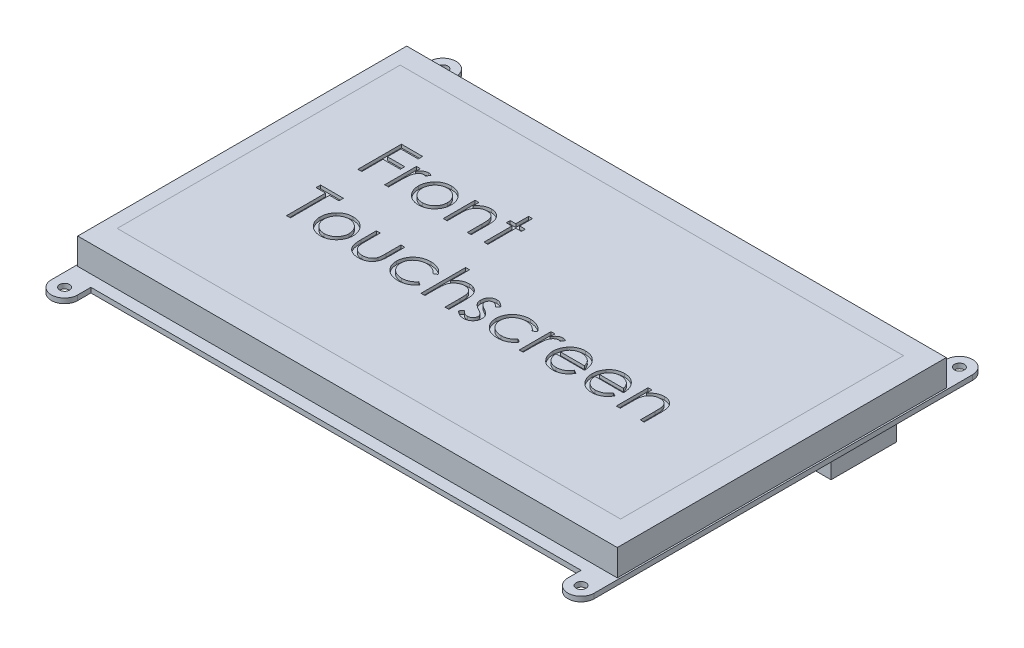
from build123d import *

# Parameters (mm, degrees)
SKETCH1_R           = 1.5
BOSS_EXTRUDE1_DEPTH = 1.5
SKETCH2_W           = 8.49594542
SKETCH2_H           = 19.836738538
SKETCH2_W_2         = 18.514132699
SKETCH2_H_2         = 9.878260544
BOSS_EXTRUDE2_DEPTH = 8
SKETCH3_W           = 164
SKETCH3_H           = 100
BOSS_EXTRUDE3_DEPTH = 8
CUT_EXTRUDE1_DEPTH  = 1


with BuildPart() as part:
    # Sketch1 → Boss-Extrude1 (new body)
    with BuildSketch(Plane(origin=(0, 0, 0), x_dir=(1, 0, 0), z_dir=(0, 1, 0))):
        with BuildLine():
            Line((-74.5, -53.5), (74.5, -53.5))
            Line((74.5, -53.5), (74.5, -57.5))
            ThreePointArc((74.5, -57.5), (78.5, -61.5), (82.5, -57.5))
            Line((82.5, -57.5), (82.5, -23.877612559))
            Line((82.5, -23.877612559), (82.5, 23.877612559))
            Line((82.5, 23.877612559), (82.5, 57.5))
            ThreePointArc((82.5, 57.5), (78.5, 61.5), (74.5, 57.5))
            Line((74.5, 57.5), (74.5, 53.5))
            Line((74.5, 53.5), (-74.5, 53.5))
            Line((-74.5, 53.5), (-74.5, 57.5))
            ThreePointArc((-74.5, 57.5), (-78.5, 61.5), (-82.5, 57.5))
            Line((-82.5, 57.5), (-82.5, 23.877612559))
            Line((-82.5, 23.877612559), (-82.5, -23.877612559))
            Line((-82.5, -23.877612559), (-82.5, -57.5))
            ThreePointArc((-82.5, -57.5), (-78.5, -61.5), (-74.5, -57.5))
            Line((-74.5, -57.5), (-74.5, -53.5))
        make_face()
        with Locations((78.5, 57.5)):
            Circle(SKETCH1_R, mode=Mode.SUBTRACT)
        with Locations((-78.5, 57.5)):
            Circle(SKETCH1_R, mode=Mode.SUBTRACT)
        with Locations((78.5, -57.5)):
            Circle(SKETCH1_R, mode=Mode.SUBTRACT)
        with Locations((-78.5, -57.5)):
            Circle(SKETCH1_R, mode=Mode.SUBTRACT)
    extrude(amount=BOSS_EXTRUDE1_DEPTH)

    # Sketch2 → Boss-Extrude2 (add)
    with BuildSketch(Plane.XZ):
        with Locations((74.922222093, -27.720858346)):
            Rectangle(SKETCH2_W, SKETCH2_H)
        with Locations((-9.25706635, -10.936720321)):
            Rectangle(SKETCH2_W_2, SKETCH2_H_2)
    extrude(amount=BOSS_EXTRUDE2_DEPTH)

    # Sketch3 → Boss-Extrude3 (add)
    with BuildSketch(Plane(origin=(0, 1.5, 0), x_dir=(1, 0, 0), z_dir=(0, 1, 0))):
        Rectangle(SKETCH3_W, SKETCH3_H)
    extrude(amount=BOSS_EXTRUDE3_DEPTH)

    # Sketch5 → Cut-Extrude1 (cut)
    # profile 1 of 16: a face of its own
    with BuildSketch(Plane(origin=(0, 9.5, 0), x_dir=(1, 0, 0), z_dir=(0, 1, 0))):
        Polygon((-56.987931451, 23.371022827), (-50.542952819, 23.371022827), (-50.542952819, 22.01418522), (-55.800698545, 22.01418522), (-55.800698545, 17.9436724), (-50.542952819, 17.9436724), (-50.542952819, 16.586834793), (-55.800698545, 16.586834793), (-55.800698545, 10.14185616), (-56.987931451, 10.14185616), align=None)
    # profile 2 of 16: a face of its own
    with BuildSketch(Plane(origin=(0, 9.5, 0), x_dir=(1, 0, 0), z_dir=(0, 1, 0))):
        with BuildLine():
            Line((-48.84690581, 19.809324109), (-47.659672904, 19.809324109))
            Line((-47.659672904, 19.809324109), (-47.659672904, 18.386234666))
            add(Edge.make_bspline(
                [(-47.659672904, 18.386234666), (-47.572024917, 18.51873735), (-47.404398823, 18.772147705), (-47.125781501, 19.107296551), (-46.840396886, 19.384787947), (-46.546878767, 19.605917319), (-46.243068687, 19.771520476), (-45.935634376, 19.892824508), (-45.619738998, 19.964554241), (-45.407460297, 19.974130868), (-45.301107533, 19.97892881)],
                knots=[0, 0, 0, 0, 1.2804753, 2.448899062, 3.506932113, 4.484331642, 5.4025378, 6.288909075, 7.142734305, 8, 8, 8, 8], degree=3))
            add(Edge.make_bspline(
                [(-45.301107533, 19.97892881), (-45.218609216, 19.974428903), (-45.048863566, 19.965170052), (-44.791905563, 19.900117232), (-44.527157992, 19.796256849), (-44.356530516, 19.69858696), (-44.267578887, 19.647669629)],
                knots=[0, 0, 0, 0, 0.901110191, 1.854092781, 2.881294221, 4, 4, 4, 4], degree=3))
            Line((-44.267578887, 19.647669629), (-44.919496956, 18.61944113))
            add(Edge.make_bspline(
                [(-44.919496956, 18.61944113), (-44.976605459, 18.644917731), (-45.085008329, 18.693277197), (-45.2435866, 18.75051039), (-45.389792843, 18.784210429), (-45.482939626, 18.789315819), (-45.526363776, 18.791695904)],
                knots=[0, 0, 0, 0, 1.180555205, 2.24091978, 3.179933427, 4, 4, 4, 4], degree=3))
            add(Edge.make_bspline(
                [(-45.526363776, 18.791695904), (-45.621635448, 18.785345763), (-45.815962041, 18.772393315), (-46.101275476, 18.670571036), (-46.378132473, 18.506055992), (-46.598007506, 18.323602682), (-46.768256498, 18.14766309), (-46.889738898, 17.994021807), (-47.001176662, 17.821745432), (-47.107653387, 17.633779067), (-47.204665869, 17.42691328), (-47.295208815, 17.203214825), (-47.37707416, 16.962424606), (-47.423755142, 16.794669247), (-47.447667028, 16.708738172)],
                knots=[0, 0, 0, 0, 1.125678352, 2.296057538, 3.5422874, 4.923748041, 5.663163013, 6.437101912, 7.23742474, 8.08941207, 8.991984279, 9.93940061, 10.944477711, 12, 12, 12, 12], degree=3))
            add(Edge.make_bspline(
                [(-47.447667028, 16.708738172), (-47.465554348, 16.632095283), (-47.505173403, 16.46233711), (-47.54369499, 16.177537627), (-47.58175537, 15.841049393), (-47.608578898, 15.451935783), (-47.633442331, 15.011168509), (-47.647465558, 14.518076096), (-47.659194691, 13.972152418), (-47.659508664, 13.590493404), (-47.659672904, 13.390846211)],
                knots=[0, 0, 0, 0, 0.566838948, 1.255505196, 2.06880316, 3.007127437, 4.065329342, 5.249902469, 6.561414163, 8, 8, 8, 8], degree=3))
            Line((-47.659672904, 13.390846211), (-47.659672904, 10.14185616))
            Line((-47.659672904, 10.14185616), (-48.84690581, 10.14185616))
            Line((-48.84690581, 10.14185616), (-48.84690581, 19.809324109))
        make_face()
    # profile 3 of 16: a face of its own
    with BuildSketch(Plane(origin=(0, 9.5, 0), x_dir=(1, 0, 0), z_dir=(0, 1, 0))):
        with BuildLine():
            add(Edge.make_bspline(
                [(-38.410916561, 19.97892881), (-38.229520976, 19.975066305), (-37.873848565, 19.967492876), (-37.352967568, 19.886549405), (-36.855758274, 19.762772164), (-36.380316417, 19.591656439), (-35.932731014, 19.362293114), (-35.506482562, 19.088603233), (-35.102739701, 18.764365454), (-34.860747894, 18.513547755), (-34.737914758, 18.386234666)],
                knots=[0, 0, 0, 0, 1.054011418, 2.066658804, 3.057071809, 4.030435133, 4.997543892, 5.974964718, 6.972108034, 8, 8, 8, 8], degree=3))
            add(Edge.make_bspline(
                [(-34.737914758, 18.386234666), (-34.632149634, 18.26447347), (-34.422666232, 18.023307492), (-34.154054736, 17.632269907), (-33.922651815, 17.227305836), (-33.737205504, 16.803037667), (-33.590985325, 16.363169118), (-33.487171533, 15.906188302), (-33.425421809, 15.433104431), (-33.417095118, 15.111810162), (-33.412878032, 14.9490894)],
                knots=[0, 0, 0, 0, 1.025258237, 2.030674902, 3.01204498, 3.988269485, 4.97094183, 5.956517959, 6.965070386, 8, 8, 8, 8], degree=3))
            add(Edge.make_bspline(
                [(-33.412878032, 14.9490894), (-33.416587254, 14.785425492), (-33.423916848, 14.462017976), (-33.493251351, 13.985694778), (-33.601092062, 13.523827442), (-33.755426689, 13.078349641), (-33.953327876, 12.647899669), (-34.194819462, 12.234357622), (-34.481596111, 11.836907595), (-34.806670741, 11.458924456), (-35.165944202, 11.110558109), (-35.555698691, 10.806936375), (-35.968274949, 10.546807399), (-36.409159052, 10.337270947), (-36.874324851, 10.172058687), (-37.364775674, 10.056019935), (-37.8797496, 9.98586119), (-38.231370348, 9.97685185), (-38.410916561, 9.97225146)],
                knots=[0, 0, 0, 0, 0.998656419, 1.973391657, 2.932242238, 3.890759089, 4.846373663, 5.82037756, 6.809684879, 7.83454468, 8.860553229, 9.859544525, 10.845671541, 11.83227036, 12.833544569, 13.85385346, 14.904124723, 16, 16, 16, 16], degree=3))
            add(Edge.make_bspline(
                [(-38.410916561, 9.97225146), (-38.591342435, 9.976867291), (-38.944715625, 9.985907629), (-39.461507283, 10.055747358), (-39.952837093, 10.172005209), (-40.418611855, 10.337813887), (-40.861391485, 10.546814097), (-41.276358304, 10.806149947), (-41.666429413, 11.110648153), (-42.025778878, 11.458900058), (-42.35083313, 11.836913881), (-42.637615037, 12.234355991), (-42.879105257, 12.647900094), (-43.077006802, 13.078349528), (-43.231341333, 13.523827473), (-43.33918207, 13.98569477), (-43.408516566, 14.462017978), (-43.415846161, 14.785425493), (-43.419555383, 14.9490894)],
                knots=[0, 0, 0, 0, 1.099876186, 2.154163076, 3.173186993, 4.173200201, 5.163417411, 6.152872554, 7.150605724, 8.17532212, 9.198891216, 10.186952605, 11.159729845, 12.11414092, 13.071450619, 14.029093627, 15.002601286, 16, 16, 16, 16], degree=3))
            add(Edge.make_bspline(
                [(-43.419555383, 14.9490894), (-43.415309537, 15.110925749), (-43.406903492, 15.431333907), (-43.345215854, 15.903528452), (-43.241807024, 16.359735845), (-43.095411568, 16.797906543), (-42.908255935, 17.220315483), (-42.680104639, 17.626280171), (-42.408753141, 18.015549536), (-42.200102907, 18.256403827), (-42.094518657, 18.378284446)],
                knots=[0, 0, 0, 0, 1.031353054, 2.041901799, 3.029428768, 4.008703097, 4.981709435, 5.96992636, 6.972712378, 8, 8, 8, 8], degree=3))
            add(Edge.make_bspline(
                [(-42.094518657, 18.378284446), (-41.971870709, 18.506701627), (-41.730661938, 18.75925661), (-41.324909307, 19.082549186), (-40.899709447, 19.361934346), (-40.447177732, 19.586740279), (-39.972126454, 19.763778724), (-39.472369198, 19.886868618), (-38.949720672, 19.967201239), (-38.592307818, 19.974980661), (-38.410916561, 19.97892881)],
                knots=[0, 0, 0, 0, 1.027980169, 2.021703884, 2.998553061, 3.971491411, 4.943284454, 5.930300938, 6.949603206, 8, 8, 8, 8], degree=3))
        make_face()
        with BuildLine():
            add(Edge.make_bspline(
                [(-38.416216708, 18.791695904), (-38.544492798, 18.788049977), (-38.797733552, 18.780852242), (-39.170492102, 18.726106531), (-39.529343279, 18.63937043), (-39.874967898, 18.51613486), (-40.206200425, 18.357011045), (-40.523357987, 18.161565755), (-40.82737346, 17.932387616), (-41.112299711, 17.669835256), (-41.373792379, 17.383030723), (-41.602384731, 17.077443176), (-41.796759389, 16.758029308), (-41.95868499, 16.424456962), (-42.079286564, 16.073345755), (-42.166875071, 15.708671941), (-42.221569135, 15.329692539), (-42.228699197, 15.072060119), (-42.232322477, 14.94113918)],
                knots=[0, 0, 0, 0, 1.021534396, 2.016698045, 2.994645724, 3.958388632, 4.93408049, 5.916473867, 6.921342795, 7.962252576, 8.998418191, 10.008913653, 10.997312074, 11.973003931, 12.956656626, 13.948281152, 14.957379055, 16, 16, 16, 16], degree=3))
            add(Edge.make_bspline(
                [(-42.232322477, 14.94113918), (-42.226249066, 14.771987173), (-42.214194481, 14.436252068), (-42.116165463, 13.94181717), (-41.952175655, 13.46714767), (-41.730729687, 13.015026211), (-41.453271658, 12.59671135), (-41.126371138, 12.223756632), (-40.753536556, 11.901774548), (-40.339212285, 11.63461778), (-39.891861143, 11.422347275), (-39.418422072, 11.271916623), (-38.924631353, 11.174127785), (-38.587171447, 11.164408225), (-38.416216708, 11.159484366)],
                knots=[0, 0, 0, 0, 1.016792936, 2.018143844, 3.017858371, 4.030088057, 5.03801393, 6.028138512, 7.003788237, 7.991172063, 8.984598303, 9.972568034, 10.972917682, 12, 12, 12, 12], degree=3))
            add(Edge.make_bspline(
                [(-38.416216708, 11.159484366), (-38.245271801, 11.164436913), (-37.907831305, 11.174213104), (-37.414726678, 11.271424119), (-36.942581606, 11.423006408), (-36.495695111, 11.634379047), (-36.081559437, 11.902789067), (-35.706043413, 12.221938468), (-35.38193408, 12.597699156), (-35.104750514, 13.015580292), (-34.879678004, 13.466446742), (-34.716455783, 13.941904777), (-34.618191098, 14.436229757), (-34.606168323, 14.771979698), (-34.600110938, 14.94113918)],
                knots=[0, 0, 0, 0, 1.02726834, 2.027799167, 3.010890988, 4.004497153, 4.992059811, 5.971914811, 6.958719428, 7.966827853, 8.981595046, 9.981490638, 10.983022906, 12, 12, 12, 12], degree=3))
            add(Edge.make_bspline(
                [(-34.600110938, 14.94113918), (-34.603732971, 15.072060901), (-34.610860578, 15.329694861), (-34.665572497, 15.708663064), (-34.753094924, 16.073378325), (-34.873940025, 16.42433679), (-35.035162041, 16.758892981), (-35.233285039, 17.076505343), (-35.460943974, 17.384089311), (-35.725592021, 17.668908132), (-36.01022086, 17.932489967), (-36.314359546, 18.161654623), (-36.631046816, 18.356152082), (-36.961317054, 18.517495908), (-37.306985985, 18.638249248), (-37.66533436, 18.72660735), (-38.036502481, 18.78062089), (-38.288835769, 18.787980621), (-38.416216708, 18.791695904)],
                knots=[0, 0, 0, 0, 1.042956736, 2.052379634, 3.044323526, 4.02829302, 5.004299113, 5.996692471, 7.007513377, 8.048758398, 9.090003419, 10.095195979, 11.07790575, 12.047570684, 13.018257071, 13.989683339, 14.985167495, 16, 16, 16, 16], degree=3))
        make_face(mode=Mode.SUBTRACT)
    # profile 4 of 16: a face of its own
    with BuildSketch(Plane(origin=(0, 9.5, 0), x_dir=(1, 0, 0), z_dir=(0, 1, 0))):
        with BuildLine():
            Line((-31.038412221, 19.809324109), (-29.851179315, 19.809324109))
            Line((-29.851179315, 19.809324109), (-29.851179315, 18.065575778))
            add(Edge.make_bspline(
                [(-29.851179315, 18.065575778), (-29.724415039, 18.223731308), (-29.478424539, 18.530637632), (-29.068757565, 18.934015994), (-28.635808895, 19.266428005), (-28.182229893, 19.531403655), (-27.707404825, 19.731151319), (-27.214228031, 19.875409451), (-26.69974685, 19.961908655), (-26.349875318, 19.973211013), (-26.172877365, 19.97892881)],
                knots=[0, 0, 0, 0, 1.12780773, 2.188550248, 3.19190651, 4.159438251, 5.104880172, 6.052711206, 7.014878035, 8, 8, 8, 8], degree=3))
            add(Edge.make_bspline(
                [(-26.172877365, 19.97892881), (-25.993978837, 19.972332387), (-25.643831265, 19.959421595), (-25.134024307, 19.857304935), (-24.657874873, 19.682886858), (-24.217080718, 19.443960282), (-23.819724882, 19.146846529), (-23.470758926, 18.800704318), (-23.182124032, 18.402559003), (-22.98861019, 18.03318874), (-22.861135272, 17.705525738), (-22.780882091, 17.4248907), (-22.712729274, 17.112235784), (-22.653644989, 16.76850579), (-22.613666024, 16.391292392), (-22.582134148, 15.982141889), (-22.559536108, 15.541186813), (-22.558639522, 15.236210572), (-22.558177178, 15.078942999)],
                knots=[0, 0, 0, 0, 1.235846778, 2.418850247, 3.575807741, 4.728682307, 5.871620074, 6.994088408, 8.11269785, 9.256955736, 9.865816715, 10.540099792, 11.271859618, 12.076849838, 12.949306005, 13.892391288, 14.913166135, 16, 16, 16, 16], degree=3))
            Line((-22.558177178, 15.078942999), (-22.558177178, 10.14185616))
            Line((-22.558177178, 10.14185616), (-23.745410084, 10.14185616))
            Line((-23.745410084, 10.14185616), (-23.745410084, 14.689382202))
            add(Edge.make_bspline(
                [(-23.745410084, 14.689382202), (-23.746140364, 14.821002753), (-23.747537266, 15.072770466), (-23.751943133, 15.433242667), (-23.762563533, 15.760141341), (-23.777487216, 16.052684962), (-23.799330575, 16.310592618), (-23.822094688, 16.534389587), (-23.849932546, 16.723791726), (-23.874738795, 16.837808556), (-23.885863977, 16.888943166)],
                knots=[0, 0, 0, 0, 1.430800155, 2.736877192, 3.918605307, 4.986035426, 5.920637409, 6.731861385, 7.431261377, 8, 8, 8, 8], degree=3))
            add(Edge.make_bspline(
                [(-23.885863977, 16.888943166), (-23.926025956, 17.03904199), (-24.00332534, 17.327935787), (-24.194331764, 17.719800156), (-24.435534174, 18.053168306), (-24.729969497, 18.325979129), (-25.074793682, 18.538291518), (-25.469049847, 18.685603787), (-25.908933399, 18.777740281), (-26.218323477, 18.786914262), (-26.379583094, 18.791695904)],
                knots=[0, 0, 0, 0, 1.084156227, 2.086665306, 3.027808233, 3.945421172, 4.874247719, 5.839848303, 6.874090471, 8, 8, 8, 8], degree=3))
            add(Edge.make_bspline(
                [(-26.379583094, 18.791695904), (-26.475088922, 18.78989672), (-26.664092488, 18.78633618), (-26.944361727, 18.750612524), (-27.216217976, 18.692183243), (-27.4823896, 18.613304762), (-27.737552987, 18.504968208), (-27.989906111, 18.382014934), (-28.229946559, 18.228752347), (-28.462792733, 18.057942558), (-28.6794215, 17.868655078), (-28.880989922, 17.668915412), (-29.06067232, 17.456207028), (-29.223461658, 17.233957227), (-29.363986641, 16.999113672), (-29.486651587, 16.753942038), (-29.590729957, 16.49811963), (-29.642447277, 16.320565083), (-29.668324246, 16.23172495)],
                knots=[0, 0, 0, 0, 1.023777757, 2.026029729, 3.023749952, 4.003683103, 4.997618607, 5.993177895, 7.010360494, 8.046726602, 9.087585522, 10.09234134, 11.086953743, 12.070360549, 13.043493632, 14.017870808, 15.008233677, 16, 16, 16, 16], degree=3))
            add(Edge.make_bspline(
                [(-29.668324246, 16.23172495), (-29.68321518, 16.166504391), (-29.715631964, 16.024522646), (-29.750644578, 15.791521418), (-29.782423211, 15.521986691), (-29.809021239, 15.216232992), (-29.825294688, 14.873189834), (-29.84303839, 14.494322232), (-29.849498234, 14.078119464), (-29.850603263, 13.788356518), (-29.851179315, 13.637303042)],
                knots=[0, 0, 0, 0, 0.615963638, 1.340920617, 2.168419149, 3.115676021, 4.16674242, 5.331190069, 6.6087489, 8, 8, 8, 8], degree=3))
            Line((-29.851179315, 13.637303042), (-29.851179315, 10.14185616))
            Line((-29.851179315, 10.14185616), (-31.038412221, 10.14185616))
            Line((-31.038412221, 10.14185616), (-31.038412221, 19.809324109))
        make_face()
    # profile 5 of 16: a face of its own
    with BuildSketch(Plane(origin=(0, 9.5, 0), x_dir=(1, 0, 0), z_dir=(0, 1, 0))):
        Polygon((-18.657269058, 23.710232229), (-17.470036152, 23.710232229), (-17.470036152, 19.809324109), (-15.773989144, 19.809324109), (-15.773989144, 18.622091203), (-17.470036152, 18.622091203), (-17.470036152, 10.14185616), (-18.657269058, 10.14185616), (-18.657269058, 18.622091203), (-20.353316067, 18.622091203), (-20.353316067, 19.809324109), (-18.657269058, 19.809324109), align=None)
    # profile 6 of 16: a face of its own
    with BuildSketch(Plane(origin=(0, 9.5, 0), x_dir=(1, 0, 0), z_dir=(0, 1, 0))):
        Polygon((-58.514373759, -1.034425891), (-58.514373759, 0.322411716), (-51.560581024, 0.322411716), (-51.560581024, -1.034425891), (-54.443860938, -1.034425891), (-54.443860938, -12.906754951), (-55.631093844, -12.906754951), (-55.631093844, -1.034425891), align=None)
    # profile 7 of 16: a face of its own
    with BuildSketch(Plane(origin=(0, 9.5, 0), x_dir=(1, 0, 0), z_dir=(0, 1, 0))):
        with BuildLine():
            add(Edge.make_bspline(
                [(-45.195104595, -3.069682301), (-45.01370901, -3.073544806), (-44.658036599, -3.081118235), (-44.137155602, -3.162061706), (-43.639946308, -3.285838947), (-43.164504451, -3.456954672), (-42.716919049, -3.686317997), (-42.290670596, -3.960007878), (-41.886927735, -4.284245657), (-41.644935928, -4.535063356), (-41.522102792, -4.662376445)],
                knots=[0, 0, 0, 0, 1.054011418, 2.066658804, 3.057071809, 4.030435133, 4.997543892, 5.974964718, 6.972108034, 8, 8, 8, 8], degree=3))
            add(Edge.make_bspline(
                [(-41.522102792, -4.662376445), (-41.416337668, -4.784137641), (-41.206854267, -5.025303619), (-40.93824277, -5.416341204), (-40.706839849, -5.821305275), (-40.521393538, -6.245573444), (-40.375173359, -6.685441993), (-40.271359567, -7.142422809), (-40.209609843, -7.61550668), (-40.201283152, -7.936800949), (-40.197066067, -8.099521711)],
                knots=[0, 0, 0, 0, 1.025258237, 2.030674902, 3.01204498, 3.988269485, 4.97094183, 5.956517959, 6.965070386, 8, 8, 8, 8], degree=3))
            add(Edge.make_bspline(
                [(-40.197066067, -8.099521711), (-40.200775288, -8.263185619), (-40.208104883, -8.586593135), (-40.277439385, -9.062916333), (-40.385280097, -9.524783669), (-40.539614723, -9.97026147), (-40.73751591, -10.400711442), (-40.979007497, -10.814253489), (-41.265784145, -11.211703516), (-41.590858775, -11.589686655), (-41.950132236, -11.938053003), (-42.339886725, -12.241674736), (-42.752462983, -12.501803712), (-43.193347087, -12.711340164), (-43.658512885, -12.876552424), (-44.148963708, -12.992591176), (-44.663937634, -13.062749922), (-45.015558382, -13.071759261), (-45.195104595, -13.076359652)],
                knots=[0, 0, 0, 0, 0.998656419, 1.973391657, 2.932242238, 3.890759089, 4.846373663, 5.82037756, 6.809684879, 7.83454468, 8.860553229, 9.859544525, 10.845671541, 11.83227036, 12.833544569, 13.85385346, 14.904124723, 16, 16, 16, 16], degree=3))
            add(Edge.make_bspline(
                [(-45.195104595, -13.076359652), (-45.375530469, -13.071743821), (-45.728903659, -13.062703483), (-46.245695317, -12.992863753), (-46.737025127, -12.876605902), (-47.202799889, -12.710797224), (-47.645579519, -12.501797014), (-48.060546338, -12.242461164), (-48.450617447, -11.937962958), (-48.809966912, -11.589711053), (-49.135021164, -11.21169723), (-49.421803071, -10.81425512), (-49.663293292, -10.400711017), (-49.861194836, -9.970261583), (-50.015529367, -9.524783639), (-50.123370104, -9.062916341), (-50.1927046, -8.586593133), (-50.200034195, -8.263185619), (-50.203743417, -8.099521711)],
                knots=[0, 0, 0, 0, 1.099876186, 2.154163076, 3.173186993, 4.173200201, 5.163417411, 6.152872554, 7.150605724, 8.17532212, 9.198891216, 10.186952605, 11.159729845, 12.11414092, 13.071450619, 14.029093627, 15.002601286, 16, 16, 16, 16], degree=3))
            add(Edge.make_bspline(
                [(-50.203743417, -8.099521711), (-50.199497571, -7.937685362), (-50.191091527, -7.617277204), (-50.129403888, -7.145082659), (-50.025995059, -6.688875266), (-49.879599602, -6.250704568), (-49.69244397, -5.828295628), (-49.464292673, -5.42233094), (-49.192941175, -5.033061575), (-48.984290941, -4.792207284), (-48.878706692, -4.670326665)],
                knots=[0, 0, 0, 0, 1.031353054, 2.041901799, 3.029428768, 4.008703097, 4.981709435, 5.96992636, 6.972712378, 8, 8, 8, 8], degree=3))
            add(Edge.make_bspline(
                [(-48.878706692, -4.670326665), (-48.756058743, -4.541909484), (-48.514849972, -4.289354502), (-48.109097341, -3.966061925), (-47.683897481, -3.686676765), (-47.231365766, -3.461870832), (-46.756314488, -3.284832387), (-46.256557232, -3.161742493), (-45.733908706, -3.081409872), (-45.376495853, -3.07363045), (-45.195104595, -3.069682301)],
                knots=[0, 0, 0, 0, 1.027980169, 2.021703884, 2.998553061, 3.971491411, 4.943284454, 5.930300938, 6.949603206, 8, 8, 8, 8], degree=3))
        make_face()
        with BuildLine():
            add(Edge.make_bspline(
                [(-45.200404742, -4.256915207), (-45.328680832, -4.260561134), (-45.581921586, -4.267758869), (-45.954680136, -4.32250458), (-46.313531313, -4.409240682), (-46.659155932, -4.532476251), (-46.990388459, -4.691600066), (-47.307546021, -4.887045356), (-47.611561494, -5.116223495), (-47.896487745, -5.378775855), (-48.157980413, -5.665580388), (-48.386572765, -5.971167935), (-48.580947423, -6.290581803), (-48.742873024, -6.624154149), (-48.863474598, -6.975265356), (-48.951063106, -7.339939171), (-49.005757169, -7.718918572), (-49.012887231, -7.976550993), (-49.016510511, -8.107471931)],
                knots=[0, 0, 0, 0, 1.021534396, 2.016698045, 2.994645724, 3.958388632, 4.93408049, 5.916473867, 6.921342795, 7.962252576, 8.998418191, 10.008913653, 10.997312074, 11.973003931, 12.956656626, 13.948281152, 14.957379055, 16, 16, 16, 16], degree=3))
            add(Edge.make_bspline(
                [(-49.016510511, -8.107471931), (-49.0104371, -8.276623939), (-48.998382516, -8.612359043), (-48.900353497, -9.106793941), (-48.736363689, -9.581463441), (-48.514917721, -10.033584901), (-48.237459692, -10.451899761), (-47.910559172, -10.824854479), (-47.537724591, -11.146836564), (-47.123400319, -11.413993331), (-46.676049177, -11.626263836), (-46.202610106, -11.776694488), (-45.708819388, -11.874483326), (-45.371359481, -11.884202887), (-45.200404742, -11.889126746)],
                knots=[0, 0, 0, 0, 1.016792936, 2.018143844, 3.017858371, 4.030088057, 5.03801393, 6.028138512, 7.003788237, 7.991172063, 8.984598303, 9.972568034, 10.972917682, 12, 12, 12, 12], degree=3))
            add(Edge.make_bspline(
                [(-45.200404742, -11.889126746), (-45.029459835, -11.884174198), (-44.692019339, -11.874398007), (-44.198914712, -11.777186992), (-43.72676964, -11.625604703), (-43.279883145, -11.414232065), (-42.865747472, -11.145822044), (-42.490231448, -10.826672643), (-42.166122114, -10.450911955), (-41.888938548, -10.033030819), (-41.663866038, -9.582164369), (-41.500643817, -9.106706334), (-41.402379132, -8.612381354), (-41.390356357, -8.276631414), (-41.384298973, -8.107471931)],
                knots=[0, 0, 0, 0, 1.02726834, 2.027799167, 3.010890988, 4.004497153, 4.992059811, 5.971914811, 6.958719428, 7.966827853, 8.981595046, 9.981490638, 10.983022906, 12, 12, 12, 12], degree=3))
            add(Edge.make_bspline(
                [(-41.384298973, -8.107471931), (-41.387921005, -7.97655021), (-41.395048612, -7.71891625), (-41.449760531, -7.339948047), (-41.537282958, -6.975232786), (-41.658128059, -6.624274322), (-41.819350075, -6.28971813), (-42.017473073, -5.972105768), (-42.245132008, -5.6645218), (-42.509780055, -5.379702979), (-42.794408894, -5.116121144), (-43.09854758, -4.886956488), (-43.41523485, -4.692459029), (-43.745505088, -4.531115203), (-44.091174019, -4.410361863), (-44.449522394, -4.322003762), (-44.820690515, -4.267990221), (-45.073023803, -4.26063049), (-45.200404742, -4.256915207)],
                knots=[0, 0, 0, 0, 1.042956736, 2.052379634, 3.044323526, 4.02829302, 5.004299113, 5.996692471, 7.007513377, 8.048758398, 9.090003419, 10.095195979, 11.07790575, 12.047570684, 13.018257071, 13.989683339, 14.985167495, 16, 16, 16, 16], degree=3))
        make_face(mode=Mode.SUBTRACT)
    # profile 8 of 16: a face of its own
    with BuildSketch(Plane(origin=(0, 9.5, 0), x_dir=(1, 0, 0), z_dir=(0, 1, 0))):
        with BuildLine():
            Line((-37.992204956, -3.239287002), (-36.80497205, -3.239287002))
            Line((-36.80497205, -3.239287002), (-36.80497205, -7.723211281))
            add(Edge.make_bspline(
                [(-36.80497205, -7.723211281), (-36.804435683, -7.854832982), (-36.803409638, -8.10661913), (-36.79645132, -8.468928913), (-36.780084597, -8.799343273), (-36.759621629, -9.098053082), (-36.733306413, -9.365007806), (-36.701997282, -9.599275019), (-36.667002653, -9.803511369), (-36.632747752, -9.926517505), (-36.616816835, -9.983723934)],
                knots=[0, 0, 0, 0, 1.388932606, 2.656963016, 3.823490214, 4.879454478, 5.816252168, 6.653371382, 7.373723809, 8, 8, 8, 8], degree=3))
            add(Edge.make_bspline(
                [(-36.616816835, -9.983723934), (-36.591260144, -10.055625857), (-36.540678082, -10.19793488), (-36.448930093, -10.40351237), (-36.33543013, -10.593918943), (-36.211227804, -10.776496837), (-36.067977067, -10.94583768), (-35.907490376, -11.101655506), (-35.735139897, -11.249837637), (-35.47904204, -11.425161106), (-35.128812077, -11.613073217), (-34.668993626, -11.775209198), (-34.170427058, -11.872106494), (-33.825846125, -11.883348469), (-33.64873457, -11.889126746)],
                knots=[0, 0, 0, 0, 0.725840625, 1.436591201, 2.137033971, 2.831655856, 3.53531722, 4.242432219, 4.957935707, 5.694543706, 7.190802206, 8.724350549, 10.316345118, 12, 12, 12, 12], degree=3))
            add(Edge.make_bspline(
                [(-33.64873457, -11.889126746), (-33.471639466, -11.883225598), (-33.128993208, -11.871807968), (-32.635904485, -11.778132093), (-32.185162531, -11.621628447), (-31.781291376, -11.403130194), (-31.426122873, -11.13574204), (-31.130150814, -10.821988507), (-30.885950775, -10.471795884), (-30.779325881, -10.210522568), (-30.725703553, -10.079126579)],
                knots=[0, 0, 0, 0, 1.157059328, 2.238695713, 3.266970494, 4.264342957, 5.228770407, 6.160125903, 7.074715775, 8, 8, 8, 8], degree=3))
            add(Edge.make_bspline(
                [(-30.725703553, -10.079126579), (-30.709850362, -10.026337295), (-30.674802829, -9.909633081), (-30.637147512, -9.711650104), (-30.603226184, -9.475548771), (-30.574261203, -9.199784113), (-30.553604189, -8.885076781), (-30.54246891, -8.531525124), (-30.529888822, -8.140239031), (-30.529697883, -7.866328155), (-30.529598118, -7.723211281)],
                knots=[0, 0, 0, 0, 0.557542046, 1.232589297, 2.036731608, 2.971723315, 4.038036528, 5.22795436, 6.551621927, 8, 8, 8, 8], degree=3))
            Line((-30.529598118, -7.723211281), (-30.529598118, -3.239287002))
            Line((-30.529598118, -3.239287002), (-29.342365212, -3.239287002))
            Line((-29.342365212, -3.239287002), (-29.342365212, -7.945817451))
            add(Edge.make_bspline(
                [(-29.342365212, -7.945817451), (-29.344034713, -8.105728486), (-29.347273774, -8.415977768), (-29.368090221, -8.866843308), (-29.403807507, -9.287010127), (-29.458019441, -9.676700631), (-29.521767676, -10.035617303), (-29.604001207, -10.364220149), (-29.702192761, -10.661496737), (-29.81296063, -10.932663572), (-29.943823046, -11.178525345), (-30.083020415, -11.411872033), (-30.243753928, -11.626913782), (-30.412974754, -11.834355193), (-30.601213155, -12.023878228), (-30.804941789, -12.199831723), (-31.021293167, -12.364905385), (-31.25506841, -12.512661114), (-31.502854719, -12.645771648), (-31.764957988, -12.763760991), (-32.044588547, -12.857130851), (-32.338138603, -12.937680093), (-32.64704637, -13.000856807), (-32.971014046, -13.045407223), (-33.309932506, -13.072717254), (-33.540911714, -13.075125131), (-33.659334863, -13.076359652)],
                knots=[0, 0, 0, 0, 1.493040784, 2.896703357, 4.213163133, 5.428574705, 6.569057535, 7.615249723, 8.588095153, 9.490268104, 10.346124644, 11.18633936, 12.024365274, 12.850166724, 13.684164916, 14.514361689, 15.362232829, 16.222528818, 17.093394965, 17.986930858, 18.902426812, 19.842810585, 20.827885679, 21.843828298, 22.894529745, 24, 24, 24, 24], degree=3))
            add(Edge.make_bspline(
                [(-33.659334863, -13.076359652), (-33.776872283, -13.075075639), (-34.007844254, -13.072552436), (-34.346780207, -13.045558103), (-34.671645475, -13.00092603), (-34.981285076, -12.937217321), (-35.276009733, -12.857694646), (-35.557013258, -12.763187235), (-35.821005297, -12.645710414), (-36.071157515, -12.513503575), (-36.30551178, -12.363956254), (-36.525148369, -12.20003539), (-36.729772782, -12.021985688), (-36.919430152, -11.830550737), (-37.091458367, -11.623355769), (-37.248001144, -11.40206749), (-37.391468452, -11.168878524), (-37.521313821, -10.9191755), (-37.63286123, -10.644870582), (-37.731343856, -10.341366673), (-37.811892995, -10.005336327), (-37.877443396, -9.637066835), (-37.93017652, -9.238320696), (-37.966787831, -8.806791269), (-37.987258382, -8.343529695), (-37.990520549, -8.023573265), (-37.992204956, -7.858365027)],
                knots=[0, 0, 0, 0, 1.083640291, 2.129454052, 3.13281866, 4.105697902, 5.042300162, 5.946461698, 6.836384745, 7.703652036, 8.553297018, 9.397182691, 10.228592656, 11.052265423, 11.879314572, 12.708807002, 13.549817954, 14.402308542, 15.300838682, 16.27712199, 17.341985831, 18.484375296, 19.725102775, 21.0496083, 22.476576903, 24, 24, 24, 24], degree=3))
            Line((-37.992204956, -7.858365027), (-37.992204956, -3.239287002))
        make_face()
    # profile 9 of 16: a face of its own
    with BuildSketch(Plane(origin=(0, 9.5, 0), x_dir=(1, 0, 0), z_dir=(0, 1, 0))):
        with BuildLine():
            Line((-17.13082675, -5.335495102), (-18.124604295, -5.952962216))
            add(Edge.make_bspline(
                [(-18.124604295, -5.952962216), (-18.233574321, -5.817539417), (-18.448063318, -5.550982632), (-18.82051817, -5.206986753), (-19.217436313, -4.911533946), (-19.645600362, -4.670748935), (-20.104409785, -4.484703572), (-20.592055205, -4.353053688), (-21.108467084, -4.271016818), (-21.462499235, -4.261692762), (-21.643901837, -4.256915207)],
                knots=[0, 0, 0, 0, 1.026593902, 2.0206758, 2.988051866, 3.946915611, 4.916868779, 5.907761954, 6.927957743, 8, 8, 8, 8], degree=3))
            add(Edge.make_bspline(
                [(-21.643901837, -4.256915207), (-21.788889561, -4.260909819), (-22.074438941, -4.268777099), (-22.493637795, -4.317953666), (-22.892940737, -4.407314828), (-23.27485056, -4.525058027), (-23.636650951, -4.682864183), (-23.979289839, -4.874912963), (-24.305806423, -5.098108056), (-24.606738749, -5.35668363), (-24.882015056, -5.637892879), (-25.120513927, -5.939342859), (-25.328162455, -6.252004352), (-25.491092706, -6.583685045), (-25.624424452, -6.926796913), (-25.712140329, -7.287816546), (-25.770593195, -7.662118836), (-25.777280836, -7.917322085), (-25.780666494, -8.046520242)],
                knots=[0, 0, 0, 0, 1.112346261, 2.190735716, 3.231507886, 4.247384806, 5.251966152, 6.253067467, 7.256802811, 8.280671706, 9.291813951, 10.270744147, 11.225547591, 12.165006084, 13.100104208, 14.043489273, 15.009504848, 16, 16, 16, 16], degree=3))
            add(Edge.make_bspline(
                [(-25.780666494, -8.046520242), (-25.773941344, -8.2157372), (-25.76058166, -8.551891065), (-25.655876738, -9.048091033), (-25.484485675, -9.527832363), (-25.249921775, -9.987708953), (-24.953296892, -10.413288051), (-24.604906549, -10.794981465), (-24.204557633, -11.125393239), (-23.755777692, -11.399322128), (-23.269104078, -11.619536226), (-22.749802194, -11.776424061), (-22.202115524, -11.871116065), (-21.827137641, -11.883044778), (-21.635951617, -11.889126746)],
                knots=[0, 0, 0, 0, 0.966302908, 1.919585723, 2.883856336, 3.870342332, 4.860282998, 5.839159637, 6.814385684, 7.815993281, 8.834850808, 9.858348828, 10.908058873, 12, 12, 12, 12], degree=3))
            add(Edge.make_bspline(
                [(-21.635951617, -11.889126746), (-21.460740057, -11.884214956), (-21.116402846, -11.874561985), (-20.613062215, -11.793187629), (-20.133864338, -11.659975086), (-19.678826246, -11.47420867), (-19.248779428, -11.234089786), (-18.846502487, -10.937910777), (-18.463990816, -10.594192079), (-18.23910641, -10.32840689), (-18.124604295, -10.193079737)],
                knots=[0, 0, 0, 0, 1.039848629, 2.043578496, 3.018386758, 3.987534228, 4.954977003, 5.934852016, 6.948509513, 8, 8, 8, 8], degree=3))
            Line((-18.124604295, -10.193079737), (-17.13082675, -10.844997806))
            add(Edge.make_bspline(
                [(-17.13082675, -10.844997806), (-17.189744553, -10.931519303), (-17.307384604, -11.104275123), (-17.504036641, -11.34785854), (-17.716156243, -11.575860137), (-17.942915865, -11.78797429), (-18.181354622, -11.989276922), (-18.439617852, -12.170144481), (-18.70937799, -12.340743364), (-18.99380189, -12.494250351), (-19.289948874, -12.632235555), (-19.597402227, -12.750886706), (-19.914825924, -12.852827285), (-20.242593179, -12.933855351), (-20.581350176, -12.998530247), (-20.930220818, -13.041444536), (-21.289084951, -13.07347908), (-21.531640404, -13.075391137), (-21.654502131, -13.076359652)],
                knots=[0, 0, 0, 0, 0.954134338, 1.905101784, 2.851144739, 3.791306361, 4.734911809, 5.6936923, 6.663572882, 7.643865596, 8.638447847, 9.640600242, 10.646758161, 11.676244097, 12.717260333, 13.78922464, 14.880174919, 16, 16, 16, 16], degree=3))
            add(Edge.make_bspline(
                [(-21.654502131, -13.076359652), (-21.842019459, -13.072990826), (-22.209554784, -13.066387904), (-22.747499976, -12.99378444), (-23.261599254, -12.884331545), (-23.751676976, -12.727230527), (-24.217809439, -12.524995216), (-24.659561999, -12.27796164), (-25.075471948, -11.984078387), (-25.461426395, -11.648576252), (-25.815897933, -11.284809544), (-26.120267759, -10.89228158), (-26.384266253, -10.485424048), (-26.596263811, -10.055251137), (-26.765018563, -9.607480235), (-26.880319567, -9.138524269), (-26.954893278, -8.65224938), (-26.963523909, -8.320639974), (-26.9678994, -8.15252318)],
                knots=[0, 0, 0, 0, 1.1129367, 2.181364009, 3.217532258, 4.231199276, 5.232079859, 6.230262199, 7.231623845, 8.250719726, 9.263571943, 10.242672461, 11.195837495, 12.138959767, 13.085126421, 14.0317438, 15.002148558, 16, 16, 16, 16], degree=3))
            add(Edge.make_bspline(
                [(-26.9678994, -8.15252318), (-26.966232464, -8.038455883), (-26.962916653, -7.811557201), (-26.924884962, -7.474799062), (-26.875753829, -7.142525692), (-26.792501787, -6.818948895), (-26.696342257, -6.499161043), (-26.573592479, -6.187016583), (-26.429600957, -5.881064992), (-26.266118894, -5.582094407), (-26.08208703, -5.295023231), (-25.878428797, -5.023811462), (-25.662814788, -4.765201039), (-25.425158055, -4.528120158), (-25.175543887, -4.303087531), (-24.906910253, -4.096114858), (-24.620797957, -3.906593851), (-24.32150385, -3.731020072), (-24.009202114, -3.574691255), (-23.685780473, -3.4400061), (-23.353187773, -3.324902614), (-23.01089199, -3.233776639), (-22.661165086, -3.157359593), (-22.3012511, -3.109289162), (-21.932526927, -3.07532319), (-21.682850889, -3.071578231), (-21.556449413, -3.069682301)],
                knots=[0, 0, 0, 0, 0.990994727, 1.971252077, 2.943264845, 3.907940874, 4.872158414, 5.844625996, 6.82015047, 7.809835459, 8.804511986, 9.781214284, 10.756496977, 11.728388426, 12.696359165, 13.676225489, 14.672885716, 15.677705647, 16.690706858, 17.706033469, 18.721040654, 19.747369689, 20.783475414, 21.830280724, 22.901553713, 24, 24, 24, 24], degree=3))
            add(Edge.make_bspline(
                [(-21.556449413, -3.069682301), (-21.398152576, -3.07316683), (-21.082350144, -3.08011847), (-20.613883783, -3.13862409), (-20.152317425, -3.226830188), (-19.705749504, -3.357507253), (-19.279594524, -3.515741904), (-18.88069565, -3.693438771), (-18.518442876, -3.899793373), (-18.186097524, -4.125521186), (-17.883038039, -4.380129371), (-17.606153499, -4.666661621), (-17.349766015, -4.983626706), (-17.204408802, -5.217237654), (-17.13082675, -5.335495102)],
                knots=[0, 0, 0, 0, 1.095225653, 2.184976855, 3.262915854, 4.344593502, 5.400796181, 6.407717688, 7.363229445, 8.282371371, 9.184954523, 10.097238608, 11.036792983, 12, 12, 12, 12], degree=3))
        make_face()
    # profile 10 of 16: a face of its own
    with BuildSketch(Plane(origin=(0, 9.5, 0), x_dir=(1, 0, 0), z_dir=(0, 1, 0))):
        with BuildLine():
            Line((-14.756360938, 0.661621118), (-13.569128032, 0.661621118))
            Line((-13.569128032, 0.661621118), (-13.569128032, -5.06518761))
            add(Edge.make_bspline(
                [(-13.569128032, -5.06518761), (-13.44168466, -4.905893392), (-13.193545884, -4.595739387), (-12.775896872, -4.191073576), (-12.347003992, -3.840316883), (-11.892053669, -3.561104142), (-11.419392476, -3.340530303), (-10.927026915, -3.184094854), (-10.414865506, -3.087895768), (-10.06703235, -3.07580651), (-9.890826083, -3.069682301)],
                knots=[0, 0, 0, 0, 1.125788106, 2.19196713, 3.20547328, 4.180437432, 5.132270164, 6.079753143, 7.027236121, 8, 8, 8, 8], degree=3))
            add(Edge.make_bspline(
                [(-9.890826083, -3.069682301), (-9.711928467, -3.076279612), (-9.36178268, -3.089192141), (-8.851962866, -3.191296289), (-8.37586075, -3.365760415), (-7.934891641, -3.60451673), (-7.538679245, -3.901881286), (-7.187729243, -4.245202815), (-6.901069081, -4.64311316), (-6.706036704, -5.010718644), (-6.579137216, -5.337814529), (-6.498810373, -5.61841087), (-6.430702093, -5.931080006), (-6.37136083, -6.275660989), (-6.331810983, -6.653807916), (-6.300043528, -7.063814771), (-6.277453954, -7.505658045), (-6.276578544, -7.811517321), (-6.276125896, -7.969668112)],
                knots=[0, 0, 0, 0, 1.235656852, 2.418478516, 3.575258207, 4.727955599, 5.870717718, 6.98870536, 8.107142894, 9.245821548, 9.854588956, 10.528768408, 11.260415777, 12.065282286, 12.943670737, 13.886611085, 14.907229059, 16, 16, 16, 16], degree=3))
            Line((-6.276125896, -7.969668112), (-6.276125896, -12.906754951))
            Line((-6.276125896, -12.906754951), (-7.463358802, -12.906754951))
            Line((-7.463358802, -12.906754951), (-7.463358802, -8.359228909))
            add(Edge.make_bspline(
                [(-7.463358802, -8.359228909), (-7.464078102, -8.227607509), (-7.465454002, -7.975838172), (-7.470002358, -7.615376989), (-7.480155612, -7.288442194), (-7.496562901, -6.996081573), (-7.513818675, -6.737887537), (-7.537568118, -6.514235039), (-7.565199063, -6.3248169), (-7.590027492, -6.210801786), (-7.601162621, -6.159667945)],
                knots=[0, 0, 0, 0, 1.430932559, 2.737130458, 3.918967929, 4.986496826, 5.920444988, 6.731744033, 7.431208747, 8, 8, 8, 8], degree=3))
            add(Edge.make_bspline(
                [(-7.601162621, -6.159667945), (-7.644343548, -6.009633079), (-7.727358627, -5.721191924), (-7.920307827, -5.329372695), (-8.161301708, -4.995299419), (-8.455545821, -4.723480533), (-8.797834876, -4.510258345), (-9.190400812, -4.36259143), (-9.629548928, -4.270940815), (-9.938928003, -4.261720828), (-10.100181885, -4.256915207)],
                knots=[0, 0, 0, 0, 1.090059168, 2.095632401, 3.037101401, 3.955032261, 4.878929692, 5.839099886, 6.873700383, 8, 8, 8, 8], degree=3))
            add(Edge.make_bspline(
                [(-10.100181885, -4.256915207), (-10.195688052, -4.258713717), (-10.384692288, -4.262272922), (-10.66495659, -4.298006408), (-10.936831324, -4.356398886), (-11.202934794, -4.435413065), (-11.457627238, -4.54293042), (-11.708332514, -4.667398695), (-11.94794753, -4.819754302), (-12.180727254, -4.990696935), (-12.397373883, -5.179948705), (-12.598937683, -5.379697613), (-12.77862129, -5.592403579), (-12.941410309, -5.814654017), (-13.081935377, -6.049497403), (-13.2046003, -6.294669083), (-13.308678677, -6.550491479), (-13.360395996, -6.728046027), (-13.386272964, -6.816886161)],
                knots=[0, 0, 0, 0, 1.024319606, 2.027102035, 3.025350316, 4.005802111, 5.00026367, 5.987881639, 7.005602596, 8.042517216, 9.083927026, 10.089214625, 11.084353441, 12.06828073, 13.041928858, 14.016821737, 15.00770877, 16, 16, 16, 16], degree=3))
            add(Edge.make_bspline(
                [(-13.386272964, -6.816886161), (-13.401163061, -6.881221302), (-13.433610415, -7.021415495), (-13.468818267, -7.252639874), (-13.500333153, -7.521329435), (-13.526974993, -7.827076645), (-13.543315231, -8.171001876), (-13.560922272, -8.550758179), (-13.567476432, -8.96872433), (-13.568561045, -9.259371039), (-13.569128032, -9.411308069)],
                knots=[0, 0, 0, 0, 0.607992626, 1.324890765, 2.152360218, 3.099583803, 4.150613268, 5.323148443, 6.60066238, 8, 8, 8, 8], degree=3))
            Line((-13.569128032, -9.411308069), (-13.569128032, -12.906754951))
            Line((-13.569128032, -12.906754951), (-14.756360938, -12.906754951))
            Line((-14.756360938, -12.906754951), (-14.756360938, 0.661621118))
        make_face()
    # profile 11 of 16: a face of its own
    with BuildSketch(Plane(origin=(0, 9.5, 0), x_dir=(1, 0, 0), z_dir=(0, 1, 0))):
        with BuildLine():
            Line((1.016876241, -4.445070422), (0.211253912, -5.274543412))
            add(Edge.make_bspline(
                [(0.211253912, -5.274543412), (0.141742187, -5.193984794), (0.007731765, -5.038677261), (-0.204809844, -4.83102823), (-0.416565727, -4.656641585), (-0.624637135, -4.509411321), (-0.834256188, -4.398100559), (-1.042962992, -4.316855098), (-1.25097364, -4.26657744), (-1.390016095, -4.26009727), (-1.458292362, -4.256915207)],
                knots=[0, 0, 0, 0, 1.26578478, 2.440284043, 3.530471711, 4.527705817, 5.468200915, 6.346673037, 7.188140097, 8, 8, 8, 8], degree=3))
            add(Edge.make_bspline(
                [(-1.458292362, -4.256915207), (-1.541973984, -4.260977971), (-1.706647574, -4.268972915), (-1.942602304, -4.348776655), (-2.161641869, -4.47127397), (-2.351223311, -4.645024271), (-2.511816626, -4.844460644), (-2.629040956, -5.067452706), (-2.700727858, -5.307271204), (-2.709817173, -5.473693583), (-2.714427178, -5.558101271)],
                knots=[0, 0, 0, 0, 0.99966794, 1.967205029, 2.953328237, 3.988086729, 5.028030931, 6.008226631, 6.989793394, 8, 8, 8, 8], degree=3))
            add(Edge.make_bspline(
                [(-2.714427178, -5.558101271), (-2.710228572, -5.634497986), (-2.701843196, -5.787076054), (-2.636654855, -6.012153443), (-2.532839642, -6.231595225), (-2.435812419, -6.366014543), (-2.38581807, -6.435275584)],
                knots=[0, 0, 0, 0, 0.960159726, 1.917612774, 2.927026955, 4, 4, 4, 4], degree=3))
            add(Edge.make_bspline(
                [(-2.38581807, -6.435275584), (-2.355717959, -6.472258983), (-2.291653668, -6.550973487), (-2.171425055, -6.660223171), (-2.035268571, -6.780957274), (-1.871529521, -6.901670914), (-1.687262243, -7.028790828), (-1.478470901, -7.157310794), (-1.251781551, -7.297027519), (-1.089488756, -7.385641904), (-1.005129802, -7.431703201)],
                knots=[0, 0, 0, 0, 0.66740084, 1.420478572, 2.27185888, 3.217733974, 4.268547843, 5.408967954, 6.65319498, 8, 8, 8, 8], degree=3))
            add(Edge.make_bspline(
                [(-1.005129802, -7.431703201), (-0.90226896, -7.489325304), (-0.703575683, -7.600632233), (-0.421254807, -7.773404029), (-0.165035932, -7.945123996), (0.067251859, -8.113955656), (0.271139054, -8.284622745), (0.452811619, -8.450583612), (0.607738178, -8.616852724), (0.694498555, -8.733016576), (0.735968455, -8.788540808)],
                knots=[0, 0, 0, 0, 1.27191281, 2.456916733, 3.569705269, 4.599008579, 5.553216877, 6.436649441, 7.252746552, 8, 8, 8, 8], degree=3))
            add(Edge.make_bspline(
                [(0.735968455, -8.788540808), (0.804799913, -8.900671558), (0.941787289, -9.12383256), (1.085638475, -9.491295068), (1.169021061, -9.881028218), (1.180595524, -10.147623216), (1.186480942, -10.283182234)],
                knots=[0, 0, 0, 0, 0.995354457, 1.980940102, 2.973342416, 4, 4, 4, 4], degree=3))
            add(Edge.make_bspline(
                [(1.186480942, -10.283182234), (1.183761275, -10.378693591), (1.178401875, -10.566909152), (1.14114073, -10.844097348), (1.077054956, -11.109189277), (0.989766065, -11.365061335), (0.87189656, -11.606810898), (0.733754588, -11.840537196), (0.567917868, -12.061184316), (0.378584395, -12.268462528), (0.171281486, -12.457774728), (-0.049857787, -12.624174792), (-0.285105748, -12.762417079), (-0.532781455, -12.876812878), (-0.793447648, -12.967785162), (-1.06714508, -13.030765563), (-1.353003766, -13.068460225), (-1.547396195, -13.073693216), (-1.646447577, -13.076359652)],
                knots=[0, 0, 0, 0, 1.032770009, 2.035186124, 3.017557409, 3.978232242, 4.952395191, 5.920591857, 6.910227898, 7.931268572, 8.952309245, 9.941945286, 10.918353717, 11.897095711, 12.887975737, 13.898235213, 14.929059601, 16, 16, 16, 16], degree=3))
            add(Edge.make_bspline(
                [(-1.646447577, -13.076359652), (-1.780127079, -13.072607481), (-2.045628619, -13.065155275), (-2.438307022, -12.99520677), (-2.822031318, -12.886367037), (-3.193897675, -12.736250262), (-3.545589832, -12.546692508), (-3.867364458, -12.319670961), (-4.160339331, -12.062684959), (-4.327095901, -11.865710564), (-4.410474186, -11.767223367)],
                knots=[0, 0, 0, 0, 1.013940152, 2.01379169, 3.017749504, 4.037548394, 5.051665909, 6.043208538, 7.021604269, 8, 8, 8, 8], degree=3))
            Line((-4.410474186, -11.767223367), (-3.623402371, -10.87149854))
            add(Edge.make_bspline(
                [(-3.623402371, -10.87149854), (-3.548667358, -10.952214466), (-3.403782235, -11.108694492), (-3.172078231, -11.317051375), (-2.936298947, -11.491681179), (-2.698798792, -11.637744086), (-2.456062126, -11.750288021), (-2.209449239, -11.829355325), (-1.959461743, -11.880171171), (-1.791556646, -11.886136702), (-1.707399266, -11.889126746)],
                knots=[0, 0, 0, 0, 1.179806542, 2.287233372, 3.337373186, 4.324005949, 5.273901747, 6.200048787, 7.097828587, 8, 8, 8, 8], degree=3))
            add(Edge.make_bspline(
                [(-1.707399266, -11.889126746), (-1.592804725, -11.883945354), (-1.368906214, -11.873821784), (-1.048217007, -11.781908966), (-0.752115651, -11.637786827), (-0.495003601, -11.433359545), (-0.276147218, -11.19540247), (-0.117668702, -10.927363983), (-0.018351015, -10.637110561), (-0.006686675, -10.435905131), (-0.000751964, -10.33353363)],
                knots=[0, 0, 0, 0, 1.072336372, 2.095165389, 3.102688358, 4.141489647, 5.156069229, 6.117746104, 7.042326257, 8, 8, 8, 8], degree=3))
            add(Edge.make_bspline(
                [(-0.000751964, -10.33353363), (-0.004857898, -10.249208583), (-0.012964515, -10.082720066), (-0.076628073, -9.841758956), (-0.177218318, -9.613199472), (-0.27626565, -9.479435032), (-0.326710999, -9.411308069)],
                knots=[0, 0, 0, 0, 1.013901739, 2.00181326, 2.98231254, 4, 4, 4, 4], degree=3))
            add(Edge.make_bspline(
                [(-0.326710999, -9.411308069), (-0.357033739, -9.377156551), (-0.42308762, -9.302762212), (-0.5442488, -9.195322181), (-0.689323101, -9.079517461), (-0.859942169, -8.957311753), (-1.056449957, -8.830317025), (-1.279642914, -8.699199533), (-1.526463455, -8.557731641), (-1.700977449, -8.463919253), (-1.792201617, -8.414880451)],
                knots=[0, 0, 0, 0, 0.615000592, 1.339693406, 2.178160186, 3.116406724, 4.166410947, 5.330106347, 6.604359322, 8, 8, 8, 8], degree=3))
            add(Edge.make_bspline(
                [(-1.792201617, -8.414880451), (-1.890651715, -8.359925995), (-2.081577873, -8.253351767), (-2.352009598, -8.08735944), (-2.595983229, -7.918527777), (-2.819369329, -7.756327462), (-3.016525511, -7.592206632), (-3.186675078, -7.425983092), (-3.336516994, -7.264360526), (-3.419472985, -7.149843958), (-3.459097817, -7.095143873)],
                knots=[0, 0, 0, 0, 1.262093308, 2.447601706, 3.550203992, 4.582594899, 5.537233252, 6.418365656, 7.244515135, 8, 8, 8, 8], degree=3))
            add(Edge.make_bspline(
                [(-3.459097817, -7.095143873), (-3.527627167, -6.984980388), (-3.664709815, -6.764614919), (-3.797814853, -6.396804486), (-3.889307879, -6.009586561), (-3.897481199, -5.742407082), (-3.901660084, -5.605802594)],
                knots=[0, 0, 0, 0, 0.985009483, 1.970363186, 2.962279964, 4, 4, 4, 4], degree=3))
            add(Edge.make_bspline(
                [(-3.901660084, -5.605802594), (-3.899640953, -5.516504214), (-3.895689227, -5.341734635), (-3.864150699, -5.08494207), (-3.806729647, -4.840965417), (-3.734706577, -4.606140667), (-3.634607126, -4.385016681), (-3.514993139, -4.174644692), (-3.374433527, -3.975315478), (-3.212496088, -3.790095306), (-3.034444185, -3.62186065), (-2.842074073, -3.475211074), (-2.639712211, -3.350076935), (-2.426501815, -3.245131239), (-2.20039467, -3.165751013), (-1.962971246, -3.11110554), (-1.714712119, -3.074611172), (-1.544996553, -3.071348919), (-1.458292362, -3.069682301)],
                knots=[0, 0, 0, 0, 1.087655834, 2.128696564, 3.144119009, 4.137814668, 5.115653402, 6.093965665, 7.082169637, 8.081268856, 9.086088321, 10.061021666, 11.022561449, 11.980240094, 12.950172527, 13.934149372, 14.944599409, 16, 16, 16, 16], degree=3))
            add(Edge.make_bspline(
                [(-1.458292362, -3.069682301), (-1.355512836, -3.073856446), (-1.148025748, -3.082283038), (-0.83674487, -3.149206333), (-0.525922416, -3.25932253), (-0.214759754, -3.411405912), (0.094463661, -3.608206306), (0.404467852, -3.846064075), (0.718974395, -4.123414365), (0.915356888, -4.33545608), (1.016876241, -4.445070422)],
                knots=[0, 0, 0, 0, 0.845714091, 1.707292901, 2.609013841, 3.555613372, 4.552488639, 5.621697636, 6.770543573, 8, 8, 8, 8], degree=3))
        make_face()
    # profile 12 of 16: a face of its own
    with BuildSketch(Plane(origin=(0, 9.5, 0), x_dir=(1, 0, 0), z_dir=(0, 1, 0))):
        with BuildLine():
            Line((13.058810002, -5.335495102), (12.065032458, -5.952962216))
            add(Edge.make_bspline(
                [(12.065032458, -5.952962216), (11.956062431, -5.817539417), (11.741573434, -5.550982632), (11.369118582, -5.206986753), (10.972200439, -4.911533946), (10.54403639, -4.670748935), (10.085226967, -4.484703572), (9.597581547, -4.353053688), (9.081169668, -4.271016818), (8.727137517, -4.261692762), (8.545734915, -4.256915207)],
                knots=[0, 0, 0, 0, 1.026593902, 2.0206758, 2.988051866, 3.946915611, 4.916868779, 5.907761954, 6.927957743, 8, 8, 8, 8], degree=3))
            add(Edge.make_bspline(
                [(8.545734915, -4.256915207), (8.400747191, -4.260909819), (8.115197811, -4.268777099), (7.695998957, -4.317953666), (7.296696015, -4.407314828), (6.914786193, -4.525058027), (6.552985801, -4.682864183), (6.210346913, -4.874912963), (5.883830329, -5.098108056), (5.582898003, -5.35668363), (5.307621696, -5.637892879), (5.069122825, -5.939342859), (4.861474298, -6.252004352), (4.698544046, -6.583685045), (4.5652123, -6.926796913), (4.477496423, -7.287816546), (4.419043557, -7.662118836), (4.412355916, -7.917322085), (4.408970258, -8.046520242)],
                knots=[0, 0, 0, 0, 1.112346261, 2.190735716, 3.231507886, 4.247384806, 5.251966152, 6.253067467, 7.256802811, 8.280671706, 9.291813951, 10.270744147, 11.225547591, 12.165006084, 13.100104208, 14.043489273, 15.009504848, 16, 16, 16, 16], degree=3))
            add(Edge.make_bspline(
                [(4.408970258, -8.046520242), (4.415695408, -8.2157372), (4.429055092, -8.551891065), (4.533760014, -9.048091033), (4.705151077, -9.527832363), (4.939714977, -9.987708953), (5.23633986, -10.413288051), (5.584730203, -10.794981465), (5.985079119, -11.125393239), (6.43385906, -11.399322128), (6.920532674, -11.619536226), (7.439834558, -11.776424061), (7.987521228, -11.871116065), (8.362499111, -11.883044778), (8.553685135, -11.889126746)],
                knots=[0, 0, 0, 0, 0.966302908, 1.919585723, 2.883856336, 3.870342332, 4.860282998, 5.839159637, 6.814385684, 7.815993281, 8.834850808, 9.858348828, 10.908058873, 12, 12, 12, 12], degree=3))
            add(Edge.make_bspline(
                [(8.553685135, -11.889126746), (8.728896695, -11.884214956), (9.073233906, -11.874561985), (9.576574537, -11.793187629), (10.055772414, -11.659975086), (10.510810506, -11.47420867), (10.940857324, -11.234089786), (11.343134265, -10.937910777), (11.725645937, -10.594192079), (11.950530342, -10.32840689), (12.065032458, -10.193079737)],
                knots=[0, 0, 0, 0, 1.039848629, 2.043578496, 3.018386758, 3.987534228, 4.954977003, 5.934852016, 6.948509513, 8, 8, 8, 8], degree=3))
            Line((12.065032458, -10.193079737), (13.058810002, -10.844997806))
            add(Edge.make_bspline(
                [(13.058810002, -10.844997806), (12.999892199, -10.931519303), (12.882252148, -11.104275123), (12.685600112, -11.34785854), (12.47348051, -11.575860137), (12.246720887, -11.78797429), (12.00828213, -11.989276922), (11.7500189, -12.170144481), (11.480258762, -12.340743364), (11.195834862, -12.494250351), (10.899687878, -12.632235555), (10.592234525, -12.750886706), (10.274810828, -12.852827285), (9.947043573, -12.933855351), (9.608286576, -12.998530247), (9.259415934, -13.041444536), (8.900551801, -13.07347908), (8.657996348, -13.075391137), (8.535134621, -13.076359652)],
                knots=[0, 0, 0, 0, 0.954134338, 1.905101784, 2.851144739, 3.791306361, 4.734911809, 5.6936923, 6.663572882, 7.643865596, 8.638447847, 9.640600242, 10.646758161, 11.676244097, 12.717260333, 13.78922464, 14.880174919, 16, 16, 16, 16], degree=3))
            add(Edge.make_bspline(
                [(8.535134621, -13.076359652), (8.347617293, -13.072990826), (7.980081969, -13.066387904), (7.442136776, -12.99378444), (6.928037498, -12.884331545), (6.437959776, -12.727230527), (5.971827313, -12.524995216), (5.530074753, -12.27796164), (5.114164804, -11.984078387), (4.728210357, -11.648576252), (4.373738819, -11.284809544), (4.069368993, -10.89228158), (3.8053705, -10.485424048), (3.593372941, -10.055251137), (3.424618189, -9.607480235), (3.309317185, -9.138524269), (3.234743474, -8.65224938), (3.226112843, -8.320639974), (3.221737352, -8.15252318)],
                knots=[0, 0, 0, 0, 1.1129367, 2.181364009, 3.217532258, 4.231199276, 5.232079859, 6.230262199, 7.231623845, 8.250719726, 9.263571943, 10.242672461, 11.195837495, 12.138959767, 13.085126421, 14.0317438, 15.002148558, 16, 16, 16, 16], degree=3))
            add(Edge.make_bspline(
                [(3.221737352, -8.15252318), (3.223404288, -8.038455883), (3.226720099, -7.811557201), (3.26475179, -7.474799062), (3.313882923, -7.142525692), (3.397134965, -6.818948895), (3.493294495, -6.499161043), (3.616044273, -6.187016583), (3.760035796, -5.881064992), (3.923517858, -5.582094407), (4.107549722, -5.295023231), (4.311207955, -5.023811462), (4.526821964, -4.765201039), (4.764478697, -4.528120158), (5.014092865, -4.303087531), (5.282726499, -4.096114858), (5.568838796, -3.906593851), (5.868132902, -3.731020072), (6.180434638, -3.574691255), (6.503856279, -3.4400061), (6.836448979, -3.324902614), (7.178744762, -3.233776639), (7.528471666, -3.157359593), (7.888385652, -3.109289162), (8.257109825, -3.07532319), (8.506785864, -3.071578231), (8.633187339, -3.069682301)],
                knots=[0, 0, 0, 0, 0.990994727, 1.971252077, 2.943264845, 3.907940874, 4.872158414, 5.844625996, 6.82015047, 7.809835459, 8.804511986, 9.781214284, 10.756496977, 11.728388426, 12.696359165, 13.676225489, 14.672885716, 15.677705647, 16.690706858, 17.706033469, 18.721040654, 19.747369689, 20.783475414, 21.830280724, 22.901553713, 24, 24, 24, 24], degree=3))
            add(Edge.make_bspline(
                [(8.633187339, -3.069682301), (8.791484176, -3.07316683), (9.107286608, -3.08011847), (9.575752969, -3.13862409), (10.037319327, -3.226830188), (10.483887248, -3.357507253), (10.910042228, -3.515741904), (11.308941102, -3.693438771), (11.671193876, -3.899793373), (12.003539228, -4.125521186), (12.306598713, -4.380129371), (12.583483253, -4.666661621), (12.839870737, -4.983626706), (12.98522795, -5.217237654), (13.058810002, -5.335495102)],
                knots=[0, 0, 0, 0, 1.095225653, 2.184976855, 3.262915854, 4.344593502, 5.400796181, 6.407717688, 7.363229445, 8.282371371, 9.184954523, 10.097238608, 11.036792983, 12, 12, 12, 12], degree=3))
        make_face()
    # profile 13 of 16: a face of its own
    with BuildSketch(Plane(origin=(0, 9.5, 0), x_dir=(1, 0, 0), z_dir=(0, 1, 0))):
        with BuildLine():
            Line((15.094066412, -3.239287002), (16.281299318, -3.239287002))
            Line((16.281299318, -3.239287002), (16.281299318, -4.662376445))
            add(Edge.make_bspline(
                [(16.281299318, -4.662376445), (16.368947305, -4.529873761), (16.536573399, -4.276463406), (16.815190721, -3.94131456), (17.100575336, -3.663823164), (17.394093455, -3.442693792), (17.697903535, -3.277090635), (18.005337847, -3.155786603), (18.321233224, -3.08405687), (18.533511926, -3.074480243), (18.639864689, -3.069682301)],
                knots=[0, 0, 0, 0, 1.2804753, 2.448899062, 3.506932113, 4.484331642, 5.4025378, 6.288909075, 7.142734305, 8, 8, 8, 8], degree=3))
            add(Edge.make_bspline(
                [(18.639864689, -3.069682301), (18.722363007, -3.074182208), (18.892108656, -3.083441059), (19.149066659, -3.148493879), (19.41381423, -3.252354262), (19.584441706, -3.350024151), (19.673393335, -3.400941482)],
                knots=[0, 0, 0, 0, 0.901110191, 1.854092781, 2.881294221, 4, 4, 4, 4], degree=3))
            Line((19.673393335, -3.400941482), (19.021475266, -4.429169981))
            add(Edge.make_bspline(
                [(19.021475266, -4.429169981), (18.964366764, -4.40369338), (18.855963893, -4.355333914), (18.697385622, -4.298100721), (18.551179379, -4.264400682), (18.458032596, -4.259295292), (18.414608446, -4.256915207)],
                knots=[0, 0, 0, 0, 1.180555205, 2.24091978, 3.179933427, 4, 4, 4, 4], degree=3))
            add(Edge.make_bspline(
                [(18.414608446, -4.256915207), (18.319336775, -4.263265348), (18.125010182, -4.276217796), (17.839696746, -4.378040075), (17.562839749, -4.54255512), (17.342964716, -4.725008429), (17.172715725, -4.900948021), (17.051233324, -5.054589304), (16.939795561, -5.22686568), (16.833318835, -5.414832044), (16.736306354, -5.621697831), (16.645763408, -5.845396286), (16.563898063, -6.086186505), (16.51721708, -6.253941864), (16.493305194, -6.339872939)],
                knots=[0, 0, 0, 0, 1.125678352, 2.296057538, 3.5422874, 4.923748041, 5.663163013, 6.437101912, 7.23742474, 8.08941207, 8.991984279, 9.93940061, 10.944477711, 12, 12, 12, 12], degree=3))
            add(Edge.make_bspline(
                [(16.493305194, -6.339872939), (16.475417874, -6.416515828), (16.435798819, -6.586274001), (16.397277232, -6.871073484), (16.359216852, -7.207561718), (16.332393324, -7.596675328), (16.307529891, -8.037442602), (16.293506664, -8.530535015), (16.281777531, -9.076458694), (16.281463558, -9.458117707), (16.281299318, -9.6577649)],
                knots=[0, 0, 0, 0, 0.566838948, 1.255505196, 2.06880316, 3.007127437, 4.065329342, 5.249902469, 6.561414163, 8, 8, 8, 8], degree=3))
            Line((16.281299318, -9.6577649), (16.281299318, -12.906754951))
            Line((16.281299318, -12.906754951), (15.094066412, -12.906754951))
            Line((15.094066412, -12.906754951), (15.094066412, -3.239287002))
        make_face()
    # profile 14 of 16: a face of its own
    with BuildSketch(Plane(origin=(0, 9.5, 0), x_dir=(1, 0, 0), z_dir=(0, 1, 0))):
        with BuildLine():
            Line((28.794946153, -9.853870335), (29.849675386, -10.407735687))
            add(Edge.make_bspline(
                [(29.849675386, -10.407735687), (29.765626351, -10.556822087), (29.602100212, -10.846885184), (29.320883099, -11.245392514), (29.026091634, -11.603894297), (28.704418898, -11.912812931), (28.365488861, -12.182126202), (28.007421982, -12.417748337), (27.628354129, -12.618523696), (27.228267372, -12.787677596), (26.803801806, -12.917737291), (26.353928813, -13.00960146), (25.877786553, -13.066385838), (25.551418552, -13.072982055), (25.384301622, -13.076359652)],
                knots=[0, 0, 0, 0, 1.120438281, 2.179929193, 3.190490725, 4.156257408, 5.095198341, 6.022838206, 6.959905092, 7.901321166, 8.864066838, 9.862729781, 10.905609505, 12, 12, 12, 12], degree=3))
            add(Edge.make_bspline(
                [(25.384301622, -13.076359652), (25.198556647, -13.072023602), (24.836222012, -13.063565225), (24.308794992, -12.990644303), (23.812212071, -12.871686281), (23.346501169, -12.705507002), (22.912802773, -12.48844539), (22.5102549, -12.224015206), (22.13674062, -11.913574838), (21.804030068, -11.554435305), (21.504507059, -11.170101716), (21.240204108, -10.769613701), (21.019248937, -10.353978894), (20.839511393, -9.925843282), (20.694350147, -9.487905351), (20.59317838, -9.036180459), (20.534857606, -8.571891197), (20.525920565, -8.257803053), (20.521416839, -8.099521711)],
                knots=[0, 0, 0, 0, 1.145258523, 2.234067595, 3.276747158, 4.290159414, 5.277019952, 6.260822364, 7.254936242, 8.264827045, 9.274100331, 10.257902744, 11.220704747, 12.172965371, 13.118907548, 14.062713208, 15.023725156, 16, 16, 16, 16], degree=3))
            add(Edge.make_bspline(
                [(20.521416839, -8.099521711), (20.525420141, -7.950996608), (20.533354157, -7.656639467), (20.583363384, -7.220963153), (20.671992348, -6.797522276), (20.793611192, -6.385964988), (20.950665009, -5.986980374), (21.142798695, -5.60032561), (21.370311552, -5.226412135), (21.545967193, -4.990543147), (21.634447689, -4.871732248)],
                knots=[0, 0, 0, 0, 1.024358464, 2.0301432, 3.019427413, 4.004406732, 4.986367066, 5.972626655, 6.978780325, 8, 8, 8, 8], degree=3))
            add(Edge.make_bspline(
                [(21.634447689, -4.871732248), (21.75429518, -4.728596935), (21.990193699, -4.446860474), (22.389171589, -4.076676921), (22.821199117, -3.766570985), (23.280862109, -3.509520202), (23.773502948, -3.31420612), (24.292499376, -3.168656628), (24.843760966, -3.087096884), (25.220622962, -3.075576798), (25.41345243, -3.069682301)],
                knots=[0, 0, 0, 0, 1.030682036, 2.02871468, 2.997146059, 3.962720338, 4.930598197, 5.918074684, 6.934738563, 8, 8, 8, 8], degree=3))
            add(Edge.make_bspline(
                [(25.41345243, -3.069682301), (25.61169189, -3.074800284), (26.000592522, -3.084840598), (26.567678218, -3.177922275), (27.104255926, -3.325531633), (27.610110927, -3.53399983), (28.085294508, -3.802965993), (28.526717969, -4.136121167), (28.941930532, -4.523237152), (29.183489743, -4.82094333), (29.306410329, -4.972435039)],
                knots=[0, 0, 0, 0, 1.056321875, 2.072262726, 3.055038591, 4.01806755, 4.982017516, 5.957941055, 6.960871419, 8, 8, 8, 8], degree=3))
            add(Edge.make_bspline(
                [(29.306410329, -4.972435039), (29.390044887, -5.086597385), (29.556757308, -5.314162179), (29.765578192, -5.685225779), (29.946845726, -6.07344737), (30.091735192, -6.485102362), (30.209057116, -6.915313276), (30.293938544, -7.367155632), (30.343716567, -7.84049488), (30.353501227, -8.163008944), (30.358489489, -8.327428028)],
                knots=[0, 0, 0, 0, 0.94817472, 1.890038105, 2.849395472, 3.817997239, 4.812318967, 5.836947057, 6.897266129, 8, 8, 8, 8], degree=3))
            Line((30.358489489, -8.327428028), (21.708649745, -8.327428028))
            add(Edge.make_bspline(
                [(21.708649745, -8.327428028), (21.714469091, -8.454807759), (21.7259126, -8.705294862), (21.77926448, -9.071821334), (21.863359548, -9.420970573), (21.981549159, -9.750123738), (22.124676819, -10.063579875), (22.300003784, -10.359013765), (22.509174122, -10.63507975), (22.742482569, -10.894247205), (23.00217903, -11.125042344), (23.275390605, -11.331613046), (23.566029972, -11.504747295), (23.871805466, -11.645278426), (24.19222263, -11.755293371), (24.527382416, -11.830389002), (24.876625296, -11.880686698), (25.114696374, -11.88627948), (25.235897508, -11.889126746)],
                knots=[0, 0, 0, 0, 1.094153842, 2.151609401, 3.174256925, 4.172055639, 5.149267565, 6.128595816, 7.11444997, 8.118368179, 9.117203808, 10.09244225, 11.054858984, 12.015122123, 12.976791628, 13.957293641, 14.960065497, 16, 16, 16, 16], degree=3))
            add(Edge.make_bspline(
                [(25.235897508, -11.889126746), (25.354397382, -11.886828436), (25.589523862, -11.882268149), (25.939684246, -11.837924319), (26.284169959, -11.766221194), (26.621555224, -11.668363196), (26.944992647, -11.549010213), (27.244521958, -11.404990484), (27.519991821, -11.245674477), (27.777457736, -11.063453383), (28.02719036, -10.840416486), (28.274925353, -10.562090993), (28.540554371, -10.232920873), (28.706824557, -9.985173862), (28.794946153, -9.853870335)],
                knots=[0, 0, 0, 0, 0.99110716, 1.966546729, 2.947904876, 3.932708344, 4.903319531, 5.828989031, 6.710028674, 7.56322171, 8.463672341, 9.504779593, 10.677557249, 12, 12, 12, 12], degree=3))
        make_face()
        with BuildLine():
            add(Edge.make_bspline(
                [(29.171256583, -7.140195122), (29.127802079, -6.982719379), (29.044166148, -6.679629265), (28.869403699, -6.259921138), (28.672585673, -5.886904369), (28.439670201, -5.563433732), (28.175772041, -5.276158549), (27.870952452, -5.025112111), (27.529126307, -4.800528293), (27.152060507, -4.610963786), (26.752759713, -4.449606284), (26.334694642, -4.341410162), (25.908119075, -4.267290761), (25.619593647, -4.260388506), (25.474404119, -4.256915207)],
                knots=[0, 0, 0, 0, 1.154881502, 2.222775134, 3.210006277, 4.132804581, 5.035138423, 5.962687519, 6.919655026, 7.923214229, 8.944639381, 9.960483929, 10.97369054, 12, 12, 12, 12], degree=3))
            add(Edge.make_bspline(
                [(25.474404119, -4.256915207), (25.355910706, -4.25922718), (25.121674139, -4.263797464), (24.77657784, -4.307151822), (24.445169454, -4.378815521), (24.125003635, -4.476956875), (23.820275948, -4.607769152), (23.524718342, -4.761164086), (23.245846011, -4.948419478), (23.0714429, -5.091138959), (22.983335075, -5.163240327)],
                knots=[0, 0, 0, 0, 1.04873581, 2.073130211, 3.073294108, 4.04793562, 5.032784715, 6.005352987, 6.992311501, 8, 8, 8, 8], degree=3))
            add(Edge.make_bspline(
                [(22.983335075, -5.163240327), (22.920238444, -5.220293246), (22.79254624, -5.33575445), (22.621925817, -5.53468032), (22.45856272, -5.749187713), (22.309890878, -5.987483273), (22.173526191, -6.246853479), (22.045921516, -6.525110612), (21.931068113, -6.824366194), (21.866448887, -7.032904878), (21.833203197, -7.140195122)],
                knots=[0, 0, 0, 0, 0.879870761, 1.780643979, 2.707998968, 3.669668524, 4.684282772, 5.740141944, 6.837334558, 8, 8, 8, 8], degree=3))
            Line((21.833203197, -7.140195122), (29.171256583, -7.140195122))
        make_face(mode=Mode.SUBTRACT)
    # profile 15 of 16: a face of its own
    with BuildSketch(Plane(origin=(0, 9.5, 0), x_dir=(1, 0, 0), z_dir=(0, 1, 0))):
        with BuildLine():
            Line((40.667275213, -9.853870335), (41.722004446, -10.407735687))
            add(Edge.make_bspline(
                [(41.722004446, -10.407735687), (41.637955411, -10.556822087), (41.474429271, -10.846885184), (41.193212159, -11.245392514), (40.898420694, -11.603894297), (40.576747958, -11.912812931), (40.237817921, -12.182126202), (39.879751042, -12.417748337), (39.500683189, -12.618523696), (39.100596431, -12.787677596), (38.676130866, -12.917737291), (38.226257873, -13.00960146), (37.750115613, -13.066385838), (37.423747612, -13.072982055), (37.256630681, -13.076359652)],
                knots=[0, 0, 0, 0, 1.120438281, 2.179929193, 3.190490725, 4.156257408, 5.095198341, 6.022838206, 6.959905092, 7.901321166, 8.864066838, 9.862729781, 10.905609505, 12, 12, 12, 12], degree=3))
            add(Edge.make_bspline(
                [(37.256630681, -13.076359652), (37.070885707, -13.072023602), (36.708551072, -13.063565225), (36.181124052, -12.990644303), (35.684541131, -12.871686281), (35.218830228, -12.705507002), (34.785131833, -12.48844539), (34.382583959, -12.224015206), (34.00906968, -11.913574838), (33.676359127, -11.554435305), (33.376836118, -11.170101716), (33.112533168, -10.769613701), (32.891577997, -10.353978894), (32.711840453, -9.925843282), (32.566679207, -9.487905351), (32.46550744, -9.036180459), (32.407186666, -8.571891197), (32.398249625, -8.257803053), (32.393745899, -8.099521711)],
                knots=[0, 0, 0, 0, 1.145258523, 2.234067595, 3.276747158, 4.290159414, 5.277019952, 6.260822364, 7.254936242, 8.264827045, 9.274100331, 10.257902744, 11.220704747, 12.172965371, 13.118907548, 14.062713208, 15.023725156, 16, 16, 16, 16], degree=3))
            add(Edge.make_bspline(
                [(32.393745899, -8.099521711), (32.397749201, -7.950996608), (32.405683217, -7.656639467), (32.455692443, -7.220963153), (32.544321408, -6.797522276), (32.665940252, -6.385964988), (32.822994069, -5.986980374), (33.015127755, -5.60032561), (33.242640611, -5.226412135), (33.418296253, -4.990543147), (33.506776749, -4.871732248)],
                knots=[0, 0, 0, 0, 1.024358464, 2.0301432, 3.019427413, 4.004406732, 4.986367066, 5.972626655, 6.978780325, 8, 8, 8, 8], degree=3))
            add(Edge.make_bspline(
                [(33.506776749, -4.871732248), (33.62662424, -4.728596935), (33.862522758, -4.446860474), (34.261500649, -4.076676921), (34.693528177, -3.766570985), (35.153191168, -3.509520202), (35.645832008, -3.31420612), (36.164828435, -3.168656628), (36.716090026, -3.087096884), (37.092952022, -3.075576798), (37.285781489, -3.069682301)],
                knots=[0, 0, 0, 0, 1.030682036, 2.02871468, 2.997146059, 3.962720338, 4.930598197, 5.918074684, 6.934738563, 8, 8, 8, 8], degree=3))
            add(Edge.make_bspline(
                [(37.285781489, -3.069682301), (37.48402095, -3.074800284), (37.872921582, -3.084840598), (38.440007277, -3.177922275), (38.976584986, -3.325531633), (39.482439987, -3.53399983), (39.957623568, -3.802965993), (40.399047029, -4.136121167), (40.814259592, -4.523237152), (41.055818803, -4.82094333), (41.178739389, -4.972435039)],
                knots=[0, 0, 0, 0, 1.056321875, 2.072262726, 3.055038591, 4.01806755, 4.982017516, 5.957941055, 6.960871419, 8, 8, 8, 8], degree=3))
            add(Edge.make_bspline(
                [(41.178739389, -4.972435039), (41.262373947, -5.086597385), (41.429086368, -5.314162179), (41.637907252, -5.685225779), (41.819174786, -6.07344737), (41.964064252, -6.485102362), (42.081386176, -6.915313276), (42.166267604, -7.367155632), (42.216045627, -7.84049488), (42.225830286, -8.163008944), (42.230818549, -8.327428028)],
                knots=[0, 0, 0, 0, 0.94817472, 1.890038105, 2.849395472, 3.817997239, 4.812318967, 5.836947057, 6.897266129, 8, 8, 8, 8], degree=3))
            Line((42.230818549, -8.327428028), (33.580978805, -8.327428028))
            add(Edge.make_bspline(
                [(33.580978805, -8.327428028), (33.586798151, -8.454807759), (33.59824166, -8.705294862), (33.65159354, -9.071821334), (33.735688607, -9.420970573), (33.853878219, -9.750123738), (33.997005878, -10.063579875), (34.172332844, -10.359013765), (34.381503181, -10.63507975), (34.614811629, -10.894247205), (34.87450809, -11.125042344), (35.147719664, -11.331613046), (35.438359032, -11.504747295), (35.744134526, -11.645278426), (36.06455169, -11.755293371), (36.399711475, -11.830389002), (36.748954356, -11.880686698), (36.987025434, -11.88627948), (37.108226568, -11.889126746)],
                knots=[0, 0, 0, 0, 1.094153842, 2.151609401, 3.174256925, 4.172055639, 5.149267565, 6.128595816, 7.11444997, 8.118368179, 9.117203808, 10.09244225, 11.054858984, 12.015122123, 12.976791628, 13.957293641, 14.960065497, 16, 16, 16, 16], degree=3))
            add(Edge.make_bspline(
                [(37.108226568, -11.889126746), (37.226726442, -11.886828436), (37.461852922, -11.882268149), (37.812013306, -11.837924319), (38.156499019, -11.766221194), (38.493884283, -11.668363196), (38.817321707, -11.549010213), (39.116851018, -11.404990484), (39.392320881, -11.245674477), (39.649786796, -11.063453383), (39.89951942, -10.840416486), (40.147254413, -10.562090993), (40.41288343, -10.232920873), (40.579153617, -9.985173862), (40.667275213, -9.853870335)],
                knots=[0, 0, 0, 0, 0.99110716, 1.966546729, 2.947904876, 3.932708344, 4.903319531, 5.828989031, 6.710028674, 7.56322171, 8.463672341, 9.504779593, 10.677557249, 12, 12, 12, 12], degree=3))
        make_face()
        with BuildLine():
            add(Edge.make_bspline(
                [(41.043585643, -7.140195122), (41.000131139, -6.982719379), (40.916495208, -6.679629265), (40.741732759, -6.259921138), (40.544914733, -5.886904369), (40.31199926, -5.563433732), (40.048101101, -5.276158549), (39.743281512, -5.025112111), (39.401455367, -4.800528293), (39.024389567, -4.610963786), (38.625088773, -4.449606284), (38.207023702, -4.341410162), (37.780448134, -4.267290761), (37.491922707, -4.260388506), (37.346733179, -4.256915207)],
                knots=[0, 0, 0, 0, 1.154881502, 2.222775134, 3.210006277, 4.132804581, 5.035138423, 5.962687519, 6.919655026, 7.923214229, 8.944639381, 9.960483929, 10.97369054, 12, 12, 12, 12], degree=3))
            add(Edge.make_bspline(
                [(37.346733179, -4.256915207), (37.228239765, -4.25922718), (36.994003199, -4.263797464), (36.6489069, -4.307151822), (36.317498514, -4.378815521), (35.997332695, -4.476956875), (35.692605008, -4.607769152), (35.397047401, -4.761164086), (35.11817507, -4.948419478), (34.94377196, -5.091138959), (34.855664135, -5.163240327)],
                knots=[0, 0, 0, 0, 1.04873581, 2.073130211, 3.073294108, 4.04793562, 5.032784715, 6.005352987, 6.992311501, 8, 8, 8, 8], degree=3))
            add(Edge.make_bspline(
                [(34.855664135, -5.163240327), (34.792567504, -5.220293246), (34.6648753, -5.33575445), (34.494254876, -5.53468032), (34.33089178, -5.749187713), (34.182219938, -5.987483273), (34.045855251, -6.246853479), (33.918250576, -6.525110612), (33.803397173, -6.824366194), (33.738777947, -7.032904878), (33.705532257, -7.140195122)],
                knots=[0, 0, 0, 0, 0.879870761, 1.780643979, 2.707998968, 3.669668524, 4.684282772, 5.740141944, 6.837334558, 8, 8, 8, 8], degree=3))
            Line((33.705532257, -7.140195122), (41.043585643, -7.140195122))
        make_face(mode=Mode.SUBTRACT)
    # profile 16 of 16: a face of its own
    with BuildSketch(Plane(origin=(0, 9.5, 0), x_dir=(1, 0, 0), z_dir=(0, 1, 0))):
        with BuildLine():
            Line((44.605284361, -3.239287002), (45.792517267, -3.239287002))
            Line((45.792517267, -3.239287002), (45.792517267, -4.983035333))
            add(Edge.make_bspline(
                [(45.792517267, -4.983035333), (45.919281542, -4.824879803), (46.165272042, -4.51797348), (46.574939016, -4.114595117), (47.007887687, -3.782183106), (47.461466688, -3.517207456), (47.936291756, -3.317459792), (48.42946855, -3.17320166), (48.943949731, -3.086702457), (49.293821263, -3.075400098), (49.470819216, -3.069682301)],
                knots=[0, 0, 0, 0, 1.12780773, 2.188550248, 3.19190651, 4.159438251, 5.104880172, 6.052711206, 7.014878035, 8, 8, 8, 8], degree=3))
            add(Edge.make_bspline(
                [(49.470819216, -3.069682301), (49.649717744, -3.076278724), (49.999865316, -3.089189516), (50.509672274, -3.191306176), (50.985821708, -3.365724253), (51.426615863, -3.604650829), (51.823971699, -3.901764582), (52.172937656, -4.247906793), (52.461572549, -4.646052108), (52.655086391, -5.015422371), (52.78256131, -5.343085373), (52.86281449, -5.623720411), (52.930967307, -5.936375327), (52.990051592, -6.280105322), (53.030030557, -6.657318719), (53.061562433, -7.066469222), (53.084160474, -7.507424299), (53.08505706, -7.812400539), (53.085519403, -7.969668112)],
                knots=[0, 0, 0, 0, 1.235846778, 2.418850247, 3.575807741, 4.728682307, 5.871620074, 6.994088408, 8.11269785, 9.256955736, 9.865816715, 10.540099792, 11.271859618, 12.076849838, 12.949306005, 13.892391288, 14.913166135, 16, 16, 16, 16], degree=3))
            Line((53.085519403, -7.969668112), (53.085519403, -12.906754951))
            Line((53.085519403, -12.906754951), (51.898286497, -12.906754951))
            Line((51.898286497, -12.906754951), (51.898286497, -8.359228909))
            add(Edge.make_bspline(
                [(51.898286497, -8.359228909), (51.897556217, -8.227608358), (51.896159315, -7.975840645), (51.891753448, -7.615368444), (51.881133048, -7.28846977), (51.866209366, -6.995926149), (51.844366006, -6.738018493), (51.821601894, -6.514221524), (51.793764035, -6.324819385), (51.768957786, -6.210802556), (51.757832605, -6.159667945)],
                knots=[0, 0, 0, 0, 1.430800155, 2.736877192, 3.918605307, 4.986035426, 5.920637409, 6.731861385, 7.431261377, 8, 8, 8, 8], degree=3))
            add(Edge.make_bspline(
                [(51.757832605, -6.159667945), (51.717670625, -6.009569121), (51.640371241, -5.720675324), (51.449364817, -5.328810956), (51.208162407, -4.995442805), (50.913727084, -4.722631982), (50.568902899, -4.510319594), (50.174646735, -4.363007324), (49.734763182, -4.270870831), (49.425373105, -4.261696849), (49.264113487, -4.256915207)],
                knots=[0, 0, 0, 0, 1.084156227, 2.086665306, 3.027808233, 3.945421172, 4.874247719, 5.839848303, 6.874090471, 8, 8, 8, 8], degree=3))
            add(Edge.make_bspline(
                [(49.264113487, -4.256915207), (49.168607659, -4.258714391), (48.979604094, -4.262274931), (48.699334855, -4.297998587), (48.427478605, -4.356427868), (48.161306981, -4.435306349), (47.906143594, -4.543642903), (47.65379047, -4.666596177), (47.413750022, -4.819858764), (47.180903849, -4.990668553), (46.964275082, -5.179956033), (46.76270666, -5.379695699), (46.583024262, -5.592404083), (46.420234923, -5.814653884), (46.27970994, -6.049497439), (46.157044994, -6.294669073), (46.052966624, -6.550491481), (46.001249304, -6.728046028), (45.975372335, -6.816886161)],
                knots=[0, 0, 0, 0, 1.023777757, 2.026029729, 3.023749952, 4.003683103, 4.997618607, 5.993177895, 7.010360494, 8.046726602, 9.087585522, 10.09234134, 11.086953743, 12.070360549, 13.043493632, 14.017870808, 15.008233677, 16, 16, 16, 16], degree=3))
            add(Edge.make_bspline(
                [(45.975372335, -6.816886161), (45.960481401, -6.88210672), (45.928064618, -7.024088465), (45.893052003, -7.257089693), (45.86127337, -7.52662442), (45.834675342, -7.832378119), (45.818401893, -8.175421278), (45.800658191, -8.554288879), (45.794198347, -8.970491647), (45.793093318, -9.260254593), (45.792517267, -9.411308069)],
                knots=[0, 0, 0, 0, 0.615963638, 1.340920617, 2.168419149, 3.115676021, 4.16674242, 5.331190069, 6.6087489, 8, 8, 8, 8], degree=3))
            Line((45.792517267, -9.411308069), (45.792517267, -12.906754951))
            Line((45.792517267, -12.906754951), (44.605284361, -12.906754951))
            Line((44.605284361, -12.906754951), (44.605284361, -3.239287002))
        make_face()
    extrude(amount=-CUT_EXTRUDE1_DEPTH, mode=Mode.SUBTRACT)


solid = part.part
